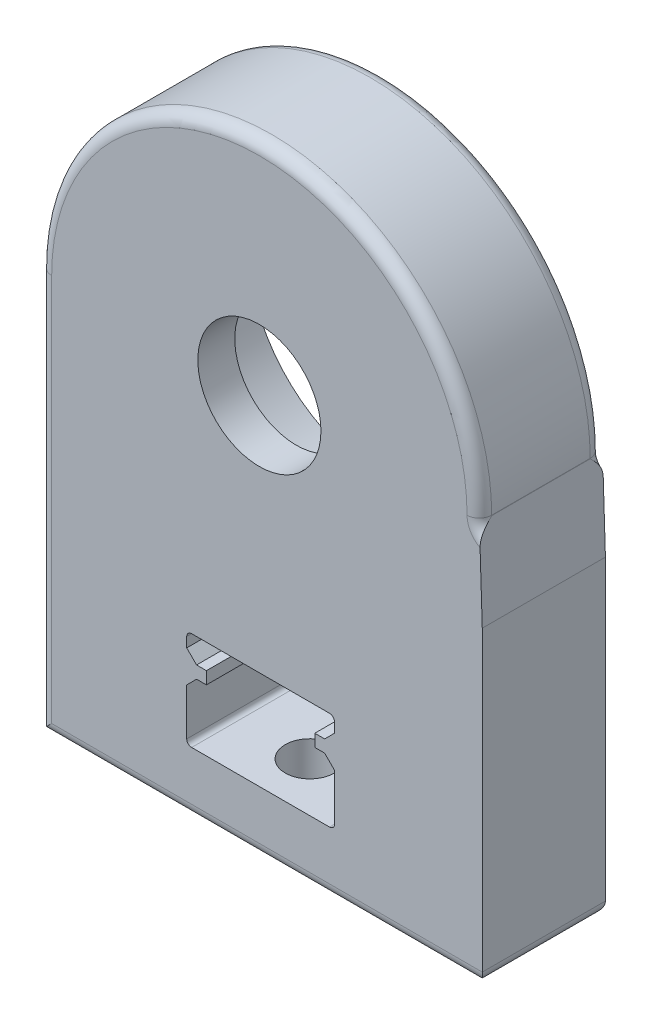
from build123d import *

# Parameters (mm, degrees)
SKETCH1_R           = 10.9
BOSS_EXTRUDE1_DEPTH = 10
FILLET5_R           = 1
FILLET1_R           = 1
SKETCH3_R           = 2
CUT_EXTRUDE2_DEPTH  = 8
SKETCH6_R           = 11.874719229
SKETCH6_R_2         = 5
BOSS_EXTRUDE3_DEPTH = 3


with BuildPart() as part:
    # Sketch1 → Boss-Extrude1 (new body)
    with BuildSketch(Plane.XY):
        with BuildLine():
            Line((18.000000111, 2.53629242), (18.000000111, -9))
            Line((18.000000111, -9), (-17.965840671, -9))
            Line((-17.965840671, -9), (-17.965840671, 23.5))
            ThreePointArc((-17.965840671, 23.5), (-0.099999918, 41.365840754), (17.765840836, 23.5))
            Line((17.765840836, 23.5), (18.000000111, 16.187309001))
            Line((18.000000111, 16.187309001), (18.000000111, 14.96196947))
            Line((18.000000111, 14.96196947), (18.000000111, 2.53629242))
        make_face()
        with Locations((-0.099999918, 23.5)):
            Circle(SKETCH1_R, mode=Mode.SUBTRACT)
        with BuildLine():
            Line((-4.4, 1), (-5.2, 1))
            Line((-5.2, 1), (-6, 0.2))
            Line((-6, 0.2), (-6, -3.6))
            ThreePointArc((-6, -3.6), (-5.882842712, -3.882842712), (-5.6, -4))
            Line((-5.6, -4), (5.6, -4))
            ThreePointArc((5.6, -4), (5.882842712, -3.882842712), (6, -3.6))
            Line((6, -3.6), (6, 0.2))
            Line((6, 0.2), (5.2, 1))
            Line((5.2, 1), (4.4, 1))
            Line((4.4, 1), (4.4, 2))
            Line((4.4, 2), (5.2, 2))
            Line((5.2, 2), (6, 2.8))
            Line((6, 2.8), (6, 3.6))
            ThreePointArc((6, 3.6), (5.882842712, 3.882842712), (5.6, 4))
            Line((5.6, 4), (-5.6, 4))
            ThreePointArc((-5.6, 4), (-5.882842712, 3.882842712), (-6, 3.6))
            Line((-6, 3.6), (-6, 2.8))
            Line((-6, 2.8), (-5.2, 2))
            Line((-5.2, 2), (-4.4, 2))
            Line((-4.4, 2), (-4.4, 1))
        make_face(mode=Mode.SUBTRACT)
    extrude(amount=-BOSS_EXTRUDE1_DEPTH)

    # Fillet5
    fillet5_edges = [part.edges().sort_by_distance(p)[0] for p in [
        (18.000000111, -9, -5),
        (-17.965840671, -9, -5),
        (0.01707972, -9, -10),
        (0.01707972, -9, 0),
    ]]
    fillet(fillet5_edges, radius=FILLET5_R)

    # Fillet1
    # the kernel refuses this fillet: 1 mm, written as the material it adds along each edge
    with BuildSketch(Plane(origin=(17.765840836, 23.5, 0), x_dir=(0.032004541259538756, -0.9994877234557543, 0), z_dir=(0, 0, -1))) as fillet1_piece_1:
        with BuildLine():
            CenterArc((0.015788393, -1), FILLET1_R, 90, 1.784765128)
            ThreePointArc((-0.015356597, -0.000485123), (-0.007678246, -0.000244212), (0, 0))
            Line((0, 0), (0.015788393, 0))
        make_face()
    extrude(amount=10)
    # the kernel refuses this fillet: 1 mm, written as the material it takes off along each edge
    with BuildSketch(Plane(origin=(-17.965840671, -10.5, -10), x_dir=(1, 0, 0), z_dir=(0, 1, 0)), Plane(origin=(-17.965840671, -10.5, 0), x_dir=(0, 0, -1), z_dir=(0, 1, 0))) as fillet1_2_piece_1:
        with BuildLine():
            CenterArc((FILLET1_R, -FILLET1_R), FILLET1_R, 90, 90)
            Line((0, -FILLET1_R), (0, 0))
            Line((0, 0), (FILLET1_R, 0))
        make_face()
    extrude(amount=34, mode=Mode.SUBTRACT)
    with BuildSketch(Plane(origin=(-0.099999918, 23.5, -10), x_dir=(-1, 0, 0), z_dir=(0, -1, 0))) as fillet1_2_piece_2:
        with BuildLine():
            CenterArc((17.865840754 - FILLET1_R, -FILLET1_R), FILLET1_R, 0, 90)
            Line((17.865840754, -FILLET1_R), (17.865840754, 0))
            Line((17.865840754, 0), (17.865840754 - FILLET1_R, 0))
        make_face()
    revolve(axis=Axis((-0.099999918, 23.5, -10), (0, 0, -1)), revolution_arc=179.950726799, mode=Mode.SUBTRACT)
    with BuildSketch(Plane(origin=(-0.099999918, 23.5, 0), x_dir=(-1, 0, 0), z_dir=(0, -1, 0))) as fillet1_2_piece_3:
        with BuildLine():
            CenterArc((17.865840754 - FILLET1_R, FILLET1_R), FILLET1_R, 270, 90)
            Line((17.865840754 - FILLET1_R, 0), (17.865840754, 0))
            Line((17.865840754, 0), (17.865840754, FILLET1_R))
        make_face()
    revolve(axis=Axis((-0.099999918, 23.5, 0), (0, 0, -1)), revolution_arc=179.950726799, mode=Mode.SUBTRACT)
    with BuildSketch(Plane(origin=(18.76583386, 23.516224236, 0), x_dir=(0.8198872609406254, -0.5725250032507568, 0), z_dir=(0.5725250032507568, 0.8198872609406254, 0))) as fillet1_2_piece_4:
        with BuildLine():
            CenterArc((1 + FILLET1_R, FILLET1_R), FILLET1_R, 180, 90)
            Line((1, FILLET1_R), (1, 0))
            Line((1, 0), (1 + FILLET1_R, 0))
        make_face()
    revolve(axis=Axis((18.76583386, 23.516224236, 0), (0, 0, -1)), revolution_arc=145.024236532, mode=Mode.SUBTRACT)
    with BuildSketch(Plane(origin=(18.76583386, 23.516224236, -10), x_dir=(0.8198872609406254, -0.5725250032507568, 0), z_dir=(0.5725250032507568, 0.8198872609406254, 0))) as fillet1_2_piece_5:
        with BuildLine():
            CenterArc((1 + FILLET1_R, -FILLET1_R), FILLET1_R, 90, 90)
            Line((1, -FILLET1_R), (1, 0))
            Line((1, 0), (1 + FILLET1_R, 0))
        make_face()
    revolve(axis=Axis((18.76583386, 23.516224236, -10), (0, 0, -1)), revolution_arc=145.024236532, mode=Mode.SUBTRACT)

    # Sketch3 → Cut-Extrude2 (cut)
    with BuildSketch(Plane.XZ.offset(9)):
        with Locations((0, -4)):
            Circle(SKETCH3_R)
    extrude(amount=-CUT_EXTRUDE2_DEPTH, mode=Mode.SUBTRACT)

    # Sketch6 → Boss-Extrude3 (add)
    with BuildSketch(Plane.XY):
        with Locations((-0.099999918, 23.5)):
            Circle(SKETCH6_R)
        with Locations((-0.099999918, 23.5)):
            Circle(SKETCH6_R_2, mode=Mode.SUBTRACT)
    extrude(amount=-BOSS_EXTRUDE3_DEPTH)


solid = part.part
